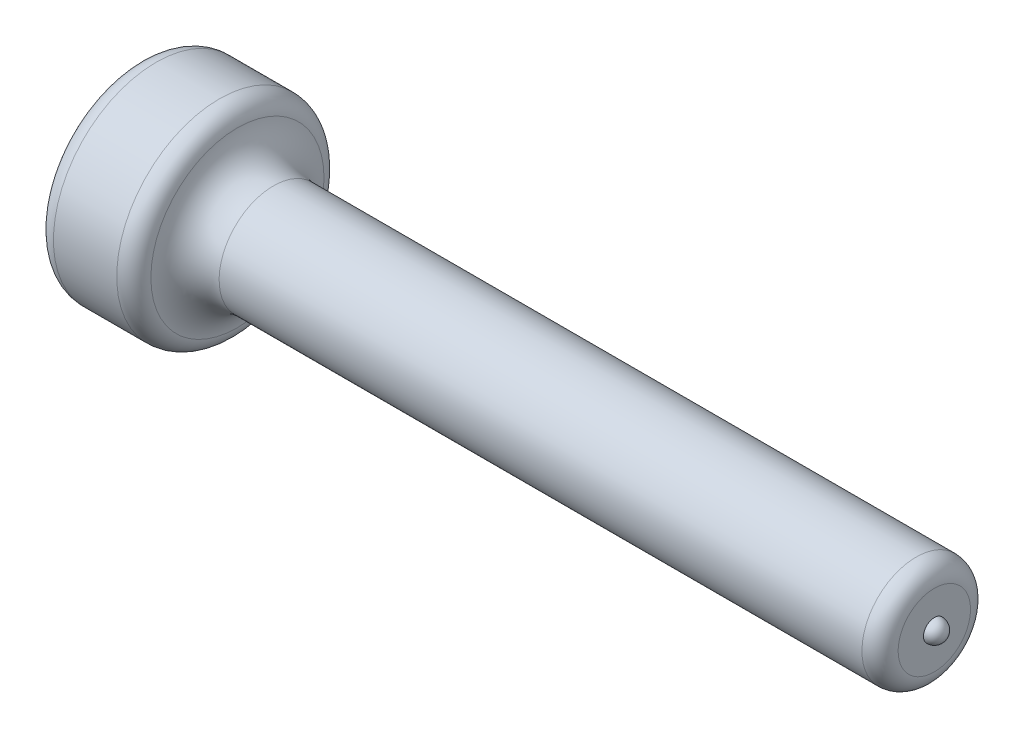
from build123d import *

# Parameters (mm, degrees)
FILLET1_R = 2
FILLET2_R = 1
FILLET3_R = 1
SKETCH3_W = 1.096
SKETCH3_H = 3.783333333


with BuildPart() as part:
    # Sketch1 → Base-Revolve (revolve)
    with BuildSketch(Plane(origin=(26.604642857, 20.929642857, 0), x_dir=(0, 1, 0), z_dir=(0, 0, 1))):
        Polygon((-20.929642857, -17.395357143), (-17.929642857, -17.395357143), (-17.929642857, 21.124642857), (-15.254642857, 21.124642857), (-15.254642857, 26.604642857), (-20.929642857, 26.604642857), align=None)
    revolve(axis=Axis((-36.5325, 0, 0), (1, 0, 0)))

    # Fillet1
    fillet1_edges = [part.edges().sort_by_distance(p)[0] for p in [
        (5.48, -3, 0),
    ]]
    fillet(fillet1_edges, radius=FILLET1_R)

    # Fillet2
    fillet2_edges = [part.edges().sort_by_distance(p)[0] for p in [
        (44, -3, 0),
    ]]
    fillet(fillet2_edges, radius=FILLET2_R)

    # Fillet3
    fillet3_edges = [part.edges().sort_by_distance(p)[0] for p in [
        (5.48, -5.675, 0),
        (0, -5.675, 0),
    ]]
    fillet(fillet3_edges, radius=FILLET3_R)

    # Sketch2 → Revolve1 (revolve)
    with BuildSketch(Plane.XY):
        with BuildLine():
            Line((43.4, 0), (44.6, 0))
            ThreePointArc((44.6, 0), (44, 0.6), (43.4, 0))
        make_face()
    revolve(axis=Axis((0, 0, 0), (1, 0, 0)))

    # Sketch3 → Cut-Revolve1 (revolve, cut)
    with BuildSketch(Plane.XY):
        with Locations((0.548, 1.891666667)):
            Rectangle(SKETCH3_W, SKETCH3_H)
    revolve(axis=Axis((0, 0, 0), (-1, 0, 0)), mode=Mode.SUBTRACT)


solid = part.part
